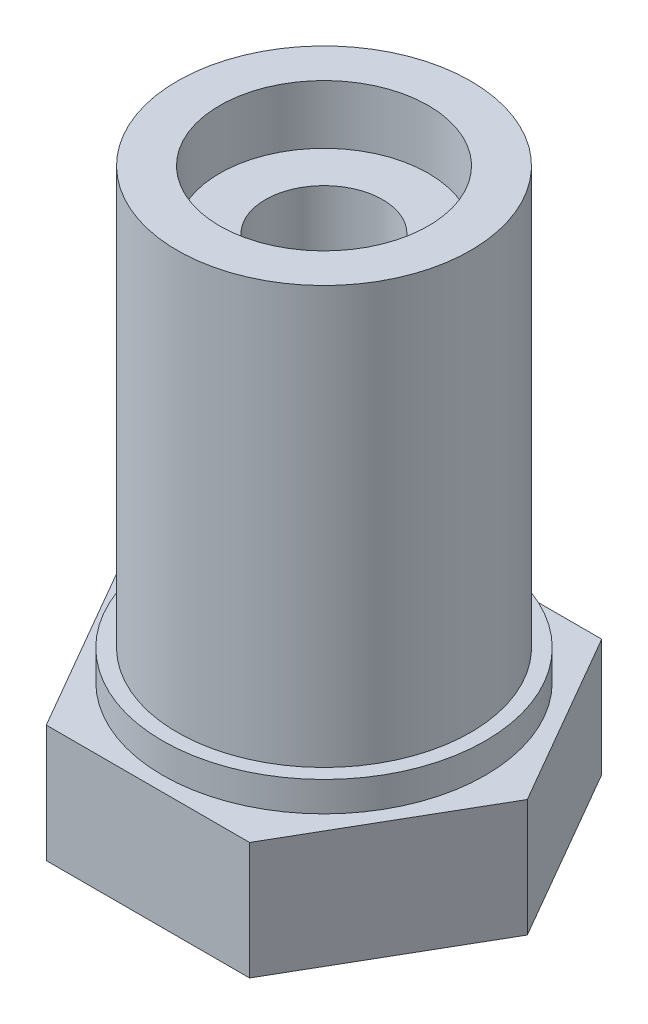
from build123d import *

# Parameters (mm, degrees)
BOSS_EXTRUDE1_DEPTH = 4
SKETCH2_R           = 5.500000049
SKETCH2_R_2         = 5.000000033
BOSS_EXTRUDE2_DEPTH = 1.016
SKETCH2_2_R         = 5.000000033
BOSS_EXTRUDE3_DEPTH = 15.24
SKETCH4_R           = 2.000000064
CUT_EXTRUDE2_DEPTH  = 22.311442936
SKETCH4_3_R         = 3.556
SKETCH4_3_R_2       = 2.000000064
CUT_EXTRUDE3_DEPTH  = 2


with BuildPart() as part:
    # Sketch1 → Boss-Extrude1 (new body)
    with BuildSketch(Plane(origin=(0, 0, 0), x_dir=(1, 0, 0), z_dir=(0, 1, 0))):
        Polygon((3.464101615, 6), (-3.464101615, 6), (-6.92820323, 0), (-3.464101615, -6), (3.464101615, -6), (6.92820323, 0), align=None)
    extrude(amount=BOSS_EXTRUDE1_DEPTH)

    # Sketch2 → Boss-Extrude2 (add)
    with BuildSketch(Plane(origin=(0, 4, 0), x_dir=(1, 0, 0), z_dir=(0, 1, 0))):
        Circle(SKETCH2_R)
        Circle(SKETCH2_R_2, mode=Mode.SUBTRACT)
    extrude(amount=BOSS_EXTRUDE2_DEPTH)

    # Sketch2<2> → Boss-Extrude3 (add)
    with BuildSketch(Plane(origin=(0, 4, 0), x_dir=(1, 0, 0), z_dir=(0, 1, 0))):
        Circle(SKETCH2_2_R)
    extrude(amount=BOSS_EXTRUDE3_DEPTH)

    # Sketch4 → Cut-Extrude2 (cut, through all)
    with BuildSketch(Plane(origin=(0, 19.24, 0), x_dir=(1, 0, 0), z_dir=(0, 1, 0))):
        Circle(SKETCH4_R)
    extrude(amount=-CUT_EXTRUDE2_DEPTH, mode=Mode.SUBTRACT)

    # Sketch4<3> → Cut-Extrude3 (cut)
    with BuildSketch(Plane(origin=(0, 19.24, 0), x_dir=(1, 0, 0), z_dir=(0, 1, 0))):
        Circle(SKETCH4_3_R)
        Circle(SKETCH4_3_R_2, mode=Mode.SUBTRACT)
    extrude(amount=-CUT_EXTRUDE3_DEPTH, mode=Mode.SUBTRACT)


solid = part.part
